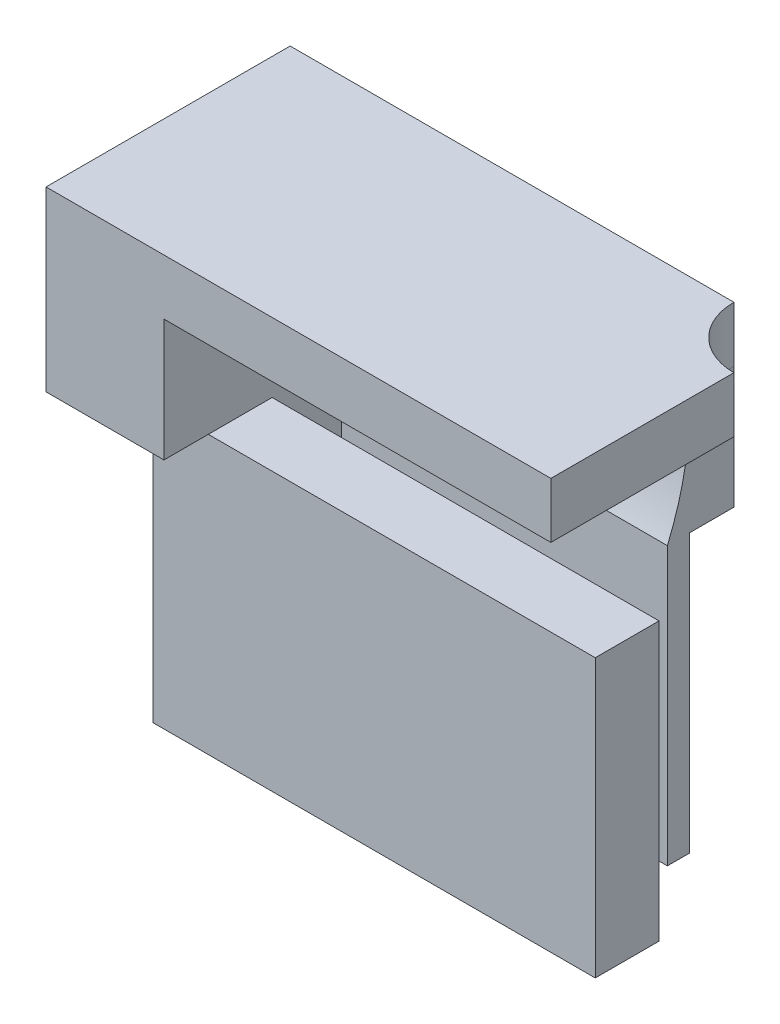
from build123d import *

# Parameters (mm, degrees)
BOSS_EXTRUDE1_DEPTH = 2
BOSS_EXTRUDE2_DEPTH = 4.4
BOSS_EXTRUDE9_DEPTH = 10
FILLET1_R           = 10
SKETCH6_W           = 13.75
SKETCH6_H           = 1
CUT_EXTRUDE2_DEPTH  = 10


with BuildPart() as part:
    # Sketch1 → Boss-Extrude1 (new body)
    with BuildSketch(Plane(origin=(0, 0, 0), x_dir=(1, 0, 0), z_dir=(0, 1, 0))):
        with BuildLine():
            Line((-43.608869745, 4.4), (-27.608869745, 4.4))
            ThreePointArc((-27.608869745, 4.4), (-26.964504664, 2.844365081), (-25.408869745, 2.2))
            Line((-25.408869745, 2.2), (-25.408869745, -4.4))
            Line((-25.408869745, -4.4), (-43.608869745, -4.4))
            Line((-43.608869745, -4.4), (-43.608869745, 4.4))
        make_face()
    extrude(amount=BOSS_EXTRUDE1_DEPTH)

    # Sketch2 → Boss-Extrude2 (add)
    with BuildSketch(Plane.XZ):
        Polygon((-39.358869745, -4.4), (-27.608869745, -4.4), (-27.608869745, -2.8), (-39.358869745, -2.8), (-39.358869745, 4.4), (-43.608869745, 4.4), (-43.608869745, -4.4), align=None)
    extrude(amount=BOSS_EXTRUDE2_DEPTH)

    # Sketch3 → Boss-Extrude9 (add)
    with BuildSketch(Plane.XZ.offset(4.4)):
        Polygon((-41.358869745, 2.8), (-25.408869745, 2.8), (-25.408869745, 0.5), (-39.358869745, 0.5), (-39.358869745, -2), (-27.608869745, -2), (-27.608869745, -2.8), (-27.608869745, -3.8), (-41.358869745, -3.8), (-41.358869745, -2.8), align=None)
    extrude(amount=BOSS_EXTRUDE9_DEPTH)

    # Fillet1
    # the kernel refuses this fillet: 10 mm, written as the material it adds along each edge
    with BuildSketch(Plane(origin=(-27.608869745, -4.4, -2.8), x_dir=(0, 1, 0), z_dir=(-1, 0, 0))) as fillet1_piece_1_section:
        with BuildLine():
            CenterArc((3.919183588, -10), FILLET1_R, 90, 23.073918066)
            Line((0, -0.8), (0, 0))
            Line((0, 0), (3.919183588, 0))
        make_face()
    fillet1_piece_1 = extrude(amount=21.547958971, mode=Mode.PRIVATE)
    fillet1_piece_1 = split(fillet1_piece_1, bisect_by=Plane(origin=(-41.358869745, -4.4, -2.8), z_dir=(1, 0, 0)), keep=Keep.TOP, mode=Mode.PRIVATE)
    add(fillet1_piece_1)

    # Sketch6 → Cut-Extrude2 (cut)
    with BuildSketch(Plane.XZ.offset(14.4)):
        with Locations((-34.483869745, -3.3)):
            Rectangle(SKETCH6_W, SKETCH6_H)
    extrude(amount=-CUT_EXTRUDE2_DEPTH, mode=Mode.SUBTRACT)


solid = part.part
